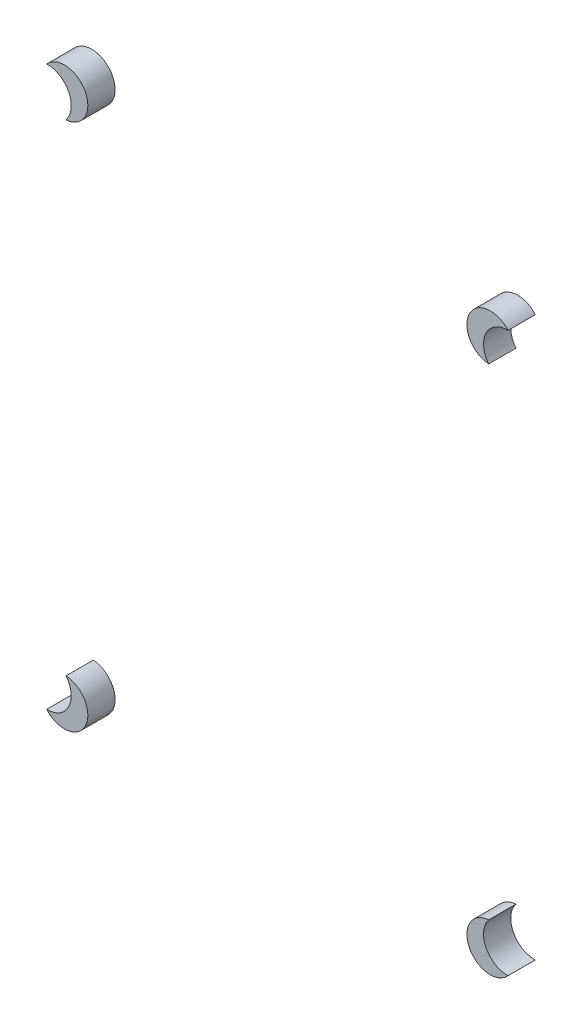
from build123d import *

# Parameters (mm, degrees)
SKETCH1_R             = 1.375
BOSS_EXTRUDE2_DEPTH   = 1.6
BOSS_EXTRUDE2_2_DEPTH = 1.6
BOSS_EXTRUDE2_3_DEPTH = 1.6
BOSS_EXTRUDE2_4_DEPTH = 1.6
SKETCH2_R             = 1.4
CUT_EXTRUDE1_DEPTH    = 22.905279044


# Read off the part's stored shape, not the designer's step: Surface-Imported1
with BuildPart() as part:
    # Sketch1 → Boss-Extrude2 (new body)
    with BuildSketch(Plane(origin=(0, 0, 0), x_dir=(-1, 0, 0), z_dir=(0, 0, -1))):
        with Locations((-12.5, 15.5)):
            Circle(SKETCH1_R)
    extrude(amount=-BOSS_EXTRUDE2_DEPTH)


with BuildPart() as body_2:
    # Sketch1 → Boss-Extrude2 2 (new body)
    with BuildSketch(Plane(origin=(0, 0, 0), x_dir=(-1, 0, 0), z_dir=(0, 0, -1))):
        with Locations((-12.5, -15.5)):
            Circle(SKETCH1_R)
    extrude(amount=-BOSS_EXTRUDE2_2_DEPTH)


with BuildPart() as body_3:
    # Sketch1 → Boss-Extrude2 3 (new body)
    with BuildSketch(Plane(origin=(0, 0, 0), x_dir=(-1, 0, 0), z_dir=(0, 0, -1))):
        with Locations((12.5, -15.5)):
            Circle(SKETCH1_R)
    extrude(amount=-BOSS_EXTRUDE2_3_DEPTH)


with BuildPart() as body_4:
    # Sketch1 → Boss-Extrude2 4 (new body)
    with BuildSketch(Plane(origin=(0, 0, 0), x_dir=(-1, 0, 0), z_dir=(0, 0, -1))):
        with Locations((12.5, 15.5)):
            Circle(SKETCH1_R)
    extrude(amount=-BOSS_EXTRUDE2_4_DEPTH)


with BuildPart() as cut_extrude1_tool:
    # Sketch2 → Cut-Extrude1 (new, through all)
    with BuildSketch(Plane(origin=(0, 0, 0), x_dir=(-1, 0, 0), z_dir=(0, 0, -1))):
        with Locations((13.5, -15)):
            Circle(SKETCH2_R)
        with Locations((13.5, 15)):
            Circle(SKETCH2_R)
        with Locations((-13.5, -15)):
            Circle(SKETCH2_R)
        with Locations((-13.5, 15)):
            Circle(SKETCH2_R)
    extrude(amount=-CUT_EXTRUDE1_DEPTH)


with BuildPart() as part_1:
    add(part.part)

    # Cut-Extrude1: cut by cut_extrude1_tool
    add(cut_extrude1_tool.part, mode=Mode.SUBTRACT)


with BuildPart() as body_2_1:
    add(body_2.part)

    # Cut-Extrude1: cut by cut_extrude1_tool
    add(cut_extrude1_tool.part, mode=Mode.SUBTRACT)


with BuildPart() as body_3_1:
    add(body_3.part)

    # Cut-Extrude1: cut by cut_extrude1_tool
    add(cut_extrude1_tool.part, mode=Mode.SUBTRACT)


with BuildPart() as body_4_1:
    add(body_4.part)

    # Cut-Extrude1: cut by cut_extrude1_tool
    add(cut_extrude1_tool.part, mode=Mode.SUBTRACT)


solid = Compound([part_1.part, body_2_1.part, body_3_1.part, body_4_1.part])
